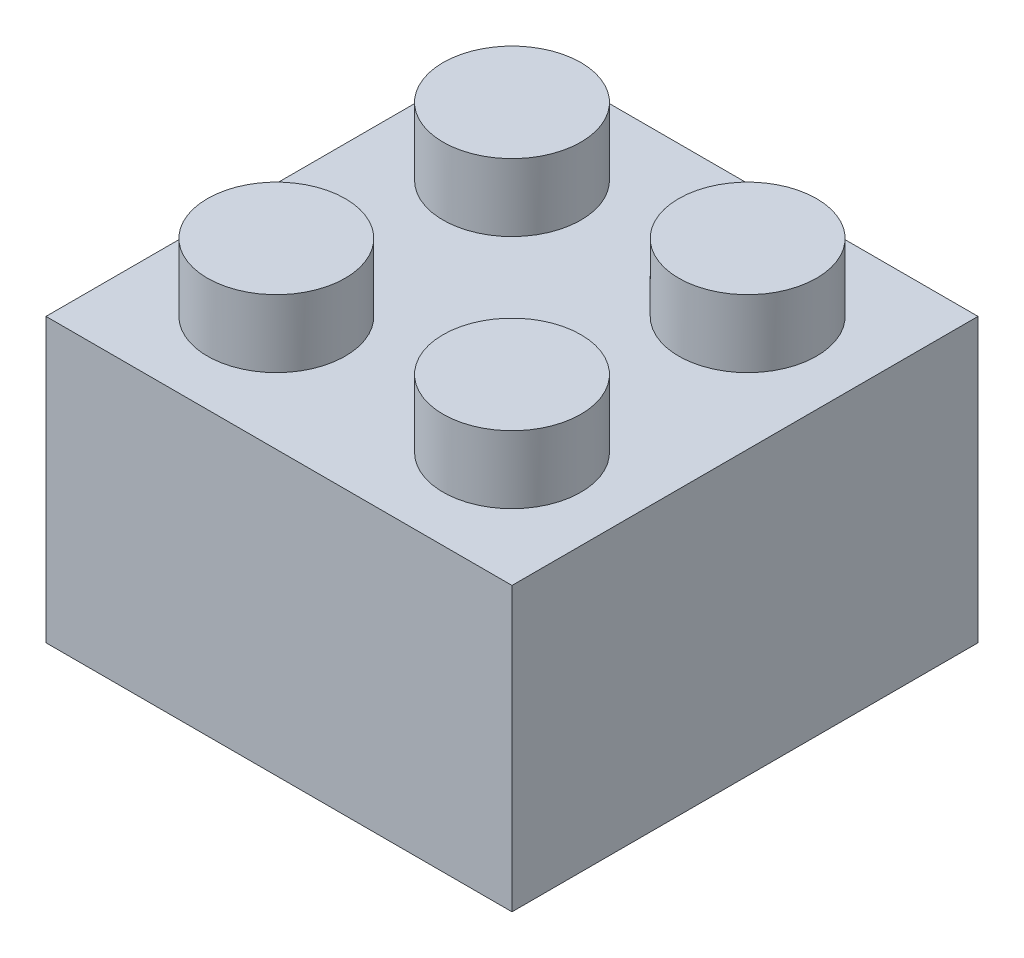
from build123d import *

# Parameters (mm, degrees)
SKETCH1_W           = 31.6
SKETCH1_H           = 31.6
BOSS_EXTRUDE1_DEPTH = 19.17
SKETCH2_R           = 4.675
BOSS_EXTRUDE2_DEPTH = 4.58
SKETCH3_R           = 6.624566363
CUT_EXTRUDE1_DEPTH  = 5.5
SKETCH4_R           = 6.624566363
CUT_EXTRUDE2_DEPTH  = 2


with BuildPart() as part:
    # Sketch1 → Boss-Extrude1 (new body)
    with BuildSketch(Plane(origin=(0, 0, 0), x_dir=(1, 0, 0), z_dir=(0, 1, 0))):
        with Locations((15.8, 15.8)):
            Rectangle(SKETCH1_W, SKETCH1_H)
    extrude(amount=BOSS_EXTRUDE1_DEPTH)

    # Sketch2 → Boss-Extrude2 (add)
    with BuildSketch(Plane(origin=(0, 19.17, 0), x_dir=(1, 0, 0), z_dir=(0, 1, 0))):
        with Locations((7.81, 23.79)):
            Circle(SKETCH2_R)
        with Locations((23.79, 7.81)):
            Circle(SKETCH2_R)
        with Locations((7.81, 7.81)):
            Circle(SKETCH2_R)
        with Locations((23.79, 23.79)):
            Circle(SKETCH2_R)
    extrude(amount=BOSS_EXTRUDE2_DEPTH)

    # Sketch3 → Cut-Extrude1 (cut)
    with BuildSketch(Plane.XZ):
        Polygon((6.81, -3.135), (8.81, -3.135), (9.445, -2.5), (22.155, -2.5), (22.79, -3.135), (24.79, -3.135), (25.425, -2.5), (29.1, -2.5), (29.1, -6.175), (28.465, -6.81), (28.465, -8.81), (29.1, -9.445), (29.1, -22.155), (28.465, -22.79), (28.465, -24.79), (29.1, -25.425), (29.1, -29.1), (25.425, -29.1), (24.79, -28.465), (22.79, -28.465), (22.155, -29.1), (9.445, -29.1), (8.81, -28.465), (6.81, -28.465), (6.175, -29.1), (2.5, -29.1), (2.5, -25.425), (3.135, -24.79), (3.135, -22.79), (2.5, -22.155), (2.5, -9.445), (3.135, -8.81), (3.135, -6.81), (2.5, -6.175), (2.5, -2.5), (6.175, -2.5), align=None)
        with Locations((15.8, -15.8)):
            Circle(SKETCH3_R, mode=Mode.SUBTRACT)
    extrude(amount=-CUT_EXTRUDE1_DEPTH, mode=Mode.SUBTRACT)

    # Sketch4 → Cut-Extrude2 (cut)
    with BuildSketch(Plane.XZ):
        with Locations((15.8, -15.8)):
            Circle(SKETCH4_R)
    extrude(amount=-CUT_EXTRUDE2_DEPTH, mode=Mode.SUBTRACT)


solid = part.part
